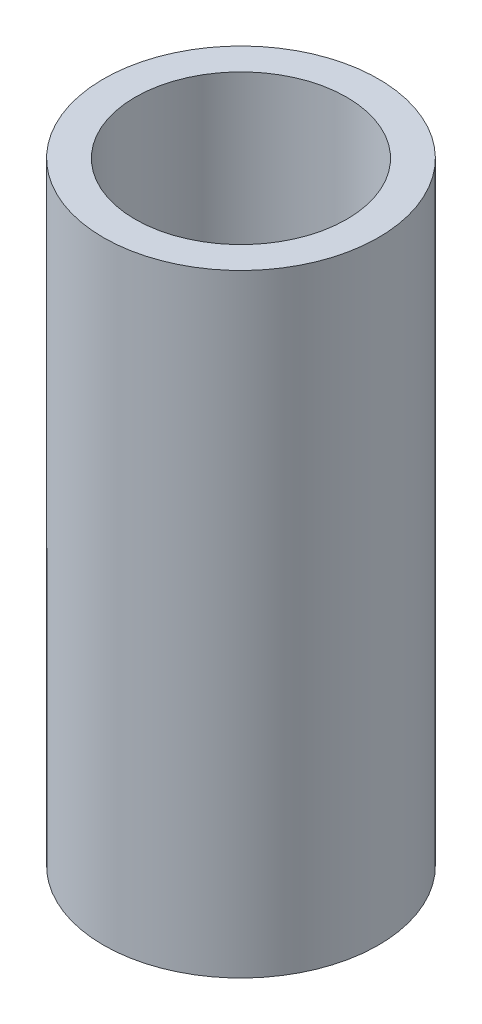
from build123d import *

# Parameters (mm, degrees)
SKETCH1_R           = 32.5
BOSS_EXTRUDE1_DEPTH = 144.860870544
SKETCH2_R           = 25.010239976
CUT_EXTRUDE1_DEPTH  = 152.977537205


with BuildPart() as part:
    # Sketch1 → Boss-Extrude1 (new body)
    with BuildSketch(Plane(origin=(0, 0, 0), x_dir=(1, 0, 0), z_dir=(0, 1, 0))):
        Circle(SKETCH1_R)
    extrude(amount=BOSS_EXTRUDE1_DEPTH)

    # Sketch2 → Cut-Extrude1 (cut, through all)
    with BuildSketch(Plane(origin=(0, 0, 0), x_dir=(1, 0, 0), z_dir=(0, 1, 0))):
        Circle(SKETCH2_R)
    extrude(amount=CUT_EXTRUDE1_DEPTH, mode=Mode.SUBTRACT)


solid = part.part
